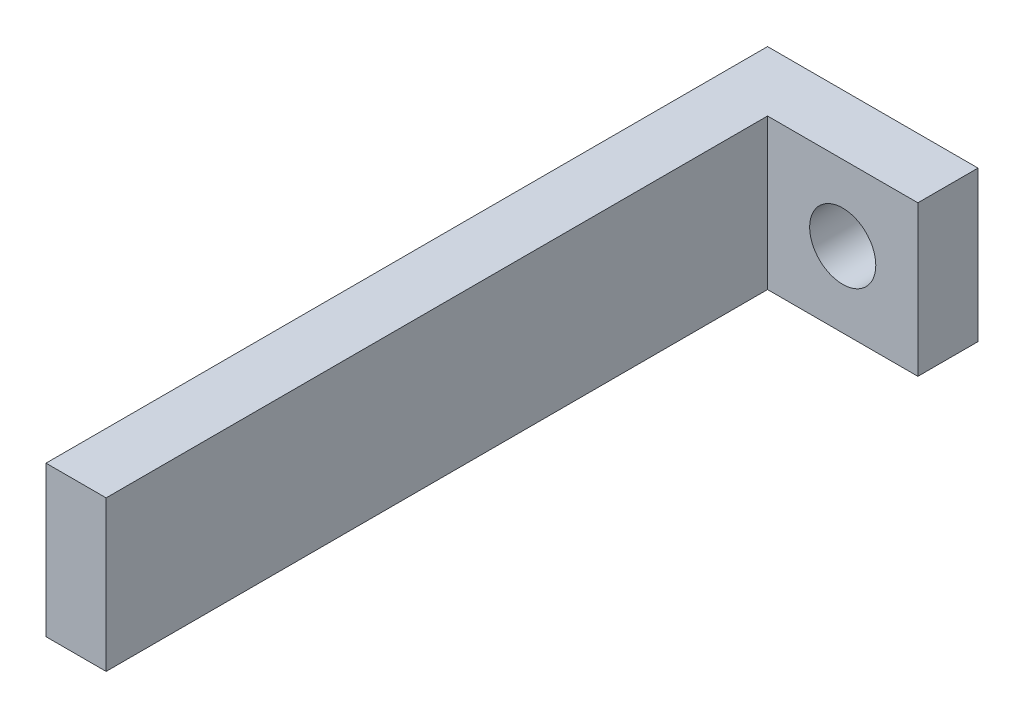
from build123d import *

# Parameters (mm, degrees)
SKETCH_1_W          = 25
SKETCH_1_H          = 25
EXTRUDE_1_DEPTH     = 10
SKETCH_2_W          = 10
SKETCH_2_H          = 25
EXTRUDE_2_DEPTH     = 120
SKETCH_6_R          = 5.5
CUT_EXTRUDE_1_DEPTH = 135.300084346


with BuildPart() as part:
    # ｽｹｯﾁ1 → ﾎﾞｽ - 押し出し1 (new body)
    with BuildSketch(Plane.XY):
        with Locations((-26.305611861, 22.91927309)):
            Rectangle(SKETCH_1_W, SKETCH_1_H)
    extrude(amount=EXTRUDE_1_DEPTH)

    # ｽｹｯﾁ2 → ﾎﾞｽ - 押し出し2 (add)
    with BuildSketch(Plane(origin=(0, 0, 0), x_dir=(-1, 0, 0), z_dir=(0, 0, -1))):
        with Locations((43.805611861, 22.91927309)):
            Rectangle(SKETCH_2_W, SKETCH_2_H)
    extrude(amount=-EXTRUDE_2_DEPTH)

    # ｽｹｯﾁ6 → ｶｯﾄ - 押し出し1 (cut, through all)
    with BuildSketch(Plane(origin=(0, 0, 0), x_dir=(-1, 0, 0), z_dir=(0, 0, -1))):
        with Locations((26.305611861, 22.91927309)):
            Circle(SKETCH_6_R)
    extrude(amount=-CUT_EXTRUDE_1_DEPTH, mode=Mode.SUBTRACT)


solid = part.part
